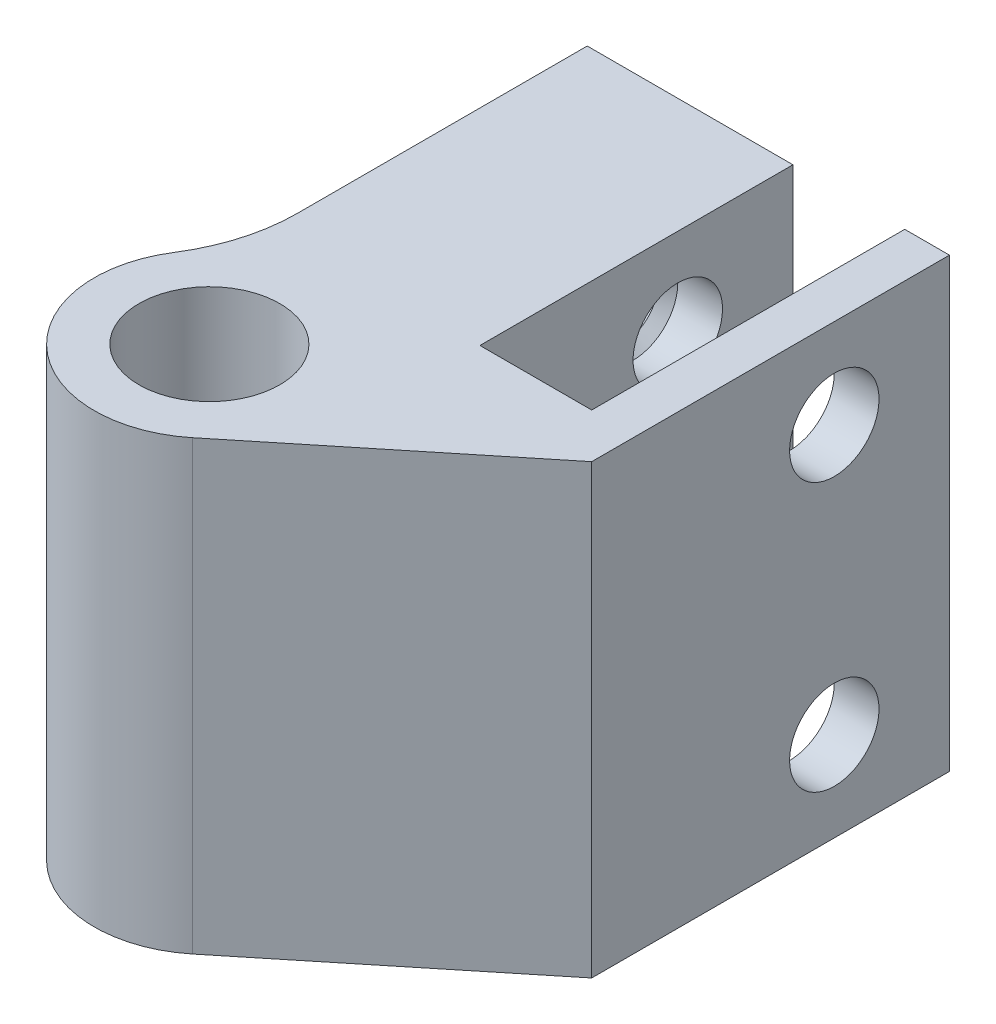
from build123d import *

# Parameters (mm, degrees)
SKETCH1_R           = 4
BOSS_EXTRUDE1_DEPTH = 25.4
SKETCH2_R           = 2.54
CUT_EXTRUDE1_DEPTH  = 39.1
SKETCH4_R           = 1.984375
CUT_EXTRUDE3_DEPTH  = 39.1
CHAMFER1_SIZE       = 1.27


with BuildPart() as part:
    # Sketch1 → Boss-Extrude1 (new body)
    with BuildSketch(Plane(origin=(0, 0, 0), x_dir=(1, 0, 0), z_dir=(0, 1, 0))):
        with BuildLine():
            Line((-3.937, 25.4), (-3.937, 8.953468099))
            ThreePointArc((-3.937, 8.953468099), (-4.340935092, 6.117132874), (-5.520621557, 3.506328226))
            ThreePointArc((-5.520621557, 3.506328226), (-4.348789534, -4.884631981), (4.121395045, -5.077962473))
            Line((4.121395045, -5.077962473), (16.637, 5.08))
            Line((16.637, 5.08), (16.637, 25.4))
            Line((16.637, 25.4), (14.097, 25.4))
            Line((14.097, 25.4), (14.097, 7.62))
            Line((14.097, 7.62), (7.747, 7.62))
            Line((7.747, 7.62), (7.747, 25.4))
            Line((7.747, 25.4), (-3.937, 25.4))
        make_face()
        with Locations(Location((0, 0, 0), (0, 0, 270))):
            Circle(SKETCH1_R, mode=Mode.SUBTRACT)
    extrude(amount=BOSS_EXTRUDE1_DEPTH)

    # Sketch2 → Cut-Extrude1 (cut, through all)
    with BuildSketch(Plane(origin=(3.937, 0, 0), x_dir=(0, 0, -1), z_dir=(1, 0, 0))):
        with Locations(Location((18.859468099, 20.32, 0), (0, 0, 180))):
            Circle(SKETCH2_R)
        with Locations(Location((18.859468099, 5.08, 0), (0, 0, 180))):
            Circle(SKETCH2_R)
    extrude(amount=CUT_EXTRUDE1_DEPTH, mode=Mode.SUBTRACT)

    # Sketch4 → Cut-Extrude3 (cut, through all)
    with BuildSketch(Plane(origin=(3.937, 0, 0), x_dir=(0, 0, -1), z_dir=(1, 0, 0))):
        with Locations((18.859468099, 20.32)):
            Circle(SKETCH4_R)
        with Locations((18.859468099, 5.08)):
            Circle(SKETCH4_R)
    extrude(amount=-CUT_EXTRUDE3_DEPTH, mode=Mode.SUBTRACT)

    # Chamfer1
    # the kernel refuses this chamfer: 1.27 mm, written as the material it adds along each edge
    with BuildSketch(Plane(origin=(3.937, 20.32, -18.859468099), x_dir=(0, 0, 1), z_dir=(0, 1, 0))) as chamfer1_piece_1_section:
        Polygon((2.54 - CHAMFER1_SIZE, 0), (2.54, CHAMFER1_SIZE), (2.54, 0), align=None)
    chamfer1_piece_1 = revolve(axis=Axis((3.937, 20.32, -18.859468099), (1, 0, 0)), mode=Mode.PRIVATE)
    chamfer1_piece_1 = chamfer1_piece_1 - Plane(origin=(4.932574819, 20.32, -18.859468099), x_dir=(0, 0, -1), z_dir=(1, 0, 0)) * Cylinder(1.984375, 11, mode=Mode.PRIVATE)
    add(chamfer1_piece_1)
    with BuildSketch(Plane(origin=(3.937, 5.08, -18.859468099), x_dir=(0, 0, 1), z_dir=(0, 1, 0))) as chamfer1_piece_2_section:
        Polygon((2.54 - CHAMFER1_SIZE, 0), (2.54, CHAMFER1_SIZE), (2.54, 0), align=None)
    chamfer1_piece_2 = revolve(axis=Axis((3.937, 5.08, -18.859468099), (1, 0, 0)), mode=Mode.PRIVATE)
    chamfer1_piece_2 = chamfer1_piece_2 - Plane(origin=(4.932574819, 5.08, -18.859468099), x_dir=(0, 0, -1), z_dir=(1, 0, 0)) * Cylinder(1.984375, 11, mode=Mode.PRIVATE)
    add(chamfer1_piece_2)


solid = part.part
